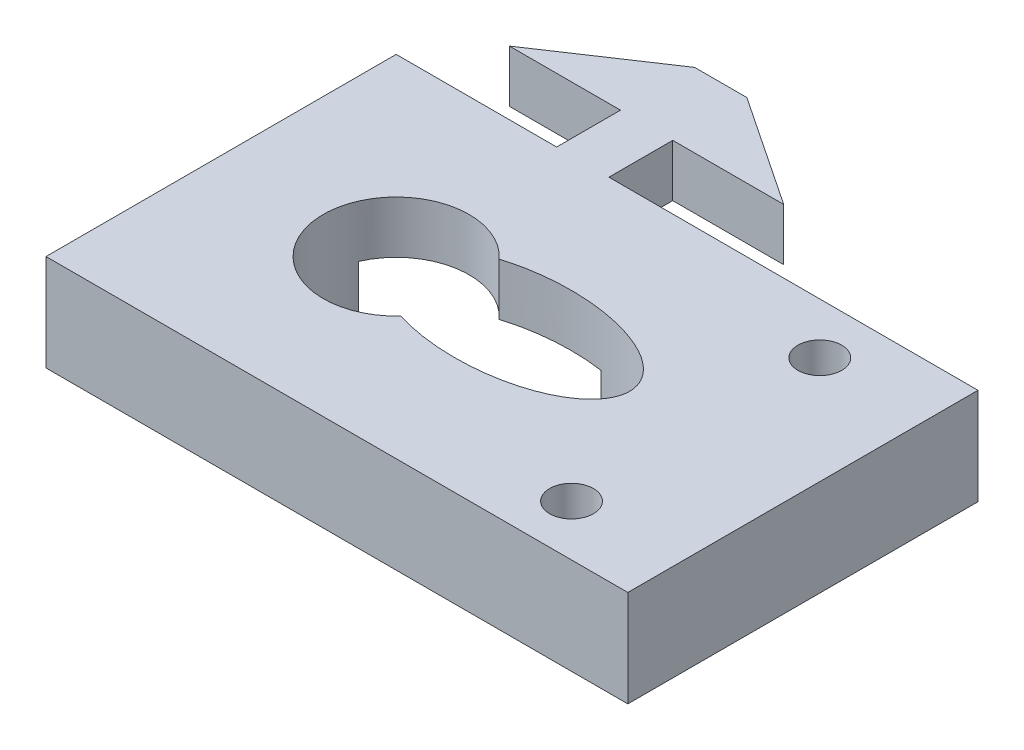
from build123d import *

# Parameters (mm, degrees)
BOSS_EXTRUDE1_DEPTH      = 3.5814
BOSS_EXTRUDE2_DEPTH      = 3.035
BOSS_EXTRUDE2_DEPTH_BACK = 3.035
SKETCH7_W                = 39.878
SKETCH7_H                = 24
CUT_EXTRUDE3_DEPTH       = 39.2533866
CUT_EXTRUDE3_DEPTH_BACK  = 39.2533866
SKETCH5_R                = 1.5
SKETCH8_W                = 18.796
SKETCH8_H                = 3.035
CUT_EXTRUDE4_DEPTH       = 10


with BuildPart() as part:
    # Sketch1 → Boss-Extrude1 (new body)
    with BuildSketch(Plane(origin=(0, 0, 0), x_dir=(1, 0, 0), z_dir=(0, 1, 0))):
        Polygon((-9.398, 2.1874988), (-1.7907, 2.1874988), (-1.7907, -2.1874988), (-12.79, -2.1874988), (-12.79, -26.1874988), (27.088, -26.1874988), (27.088, -2.1874988), (1.7907, -2.1874988), (1.7907, 2.1874988), (9.398, 2.1874988), (1.7907, 7.2674988), (-1.7907, 7.2674988), align=None)
    extrude(amount=BOSS_EXTRUDE1_DEPTH)

    # Sketch7 → Boss-Extrude2 (add, two sides: drawn at the far end of the back side and taken through both)
    with BuildSketch(Plane(origin=(0, 0, 0), x_dir=(1, 0, 0), z_dir=(0, 1, 0)).offset(-BOSS_EXTRUDE2_DEPTH_BACK)):
        with Locations((7.149, -14.1874988)):
            Rectangle(SKETCH7_W, SKETCH7_H)
    extrude(amount=BOSS_EXTRUDE2_DEPTH + BOSS_EXTRUDE2_DEPTH_BACK)

    # Sketch5 → Cut-Extrude3 (cut, two sides: drawn at the far end of the back side and taken through both)
    with BuildSketch(Plane(origin=(0, 3.5814, 0), x_dir=(1, 0, 0), z_dir=(0, 1, 0)).offset(-CUT_EXTRUDE3_DEPTH_BACK)):
        with BuildLine():
            ThreePointArc((2.902928009, -10.816700272), (-5.79, -14.1874988), (2.902928009, -17.558297328))
            add(Edge.make_bspline(
                [(2.902928009, -17.558297328), (15.21, -21.489668828), (15.21, -14.1874988)],
                knots=[1.002278043, 1.002278043, 1.002278043, 3.141592654, 3.141592654, 3.141592654], degree=2, weights=[1, 0.480424813, 1]))
            add(Edge.make_bspline(
                [(15.21, -14.1874988), (15.21, -6.885328772), (2.902928009, -10.816700272)],
                knots=[3.141592654, 3.141592654, 3.141592654, 5.280907265, 5.280907265, 5.280907265], degree=2, weights=[1, 0.480424813, 1]))
        make_face()
        with Locations((19.738, -22.6964988)):
            Circle(SKETCH5_R)
        with Locations((19.738, -5.6784988)):
            Circle(SKETCH5_R)
    extrude(amount=CUT_EXTRUDE3_DEPTH + CUT_EXTRUDE3_DEPTH_BACK, mode=Mode.SUBTRACT)

    # Sketch8 → Cut-Extrude4 (cut)
    with BuildSketch(Plane(origin=(0, 0, 2.1874988), x_dir=(-1, 0, 0), z_dir=(0, 0, -1))):
        with Locations((0, -1.5175)):
            Rectangle(SKETCH8_W, SKETCH8_H)
    extrude(amount=-CUT_EXTRUDE4_DEPTH, mode=Mode.SUBTRACT)


solid = part.part
